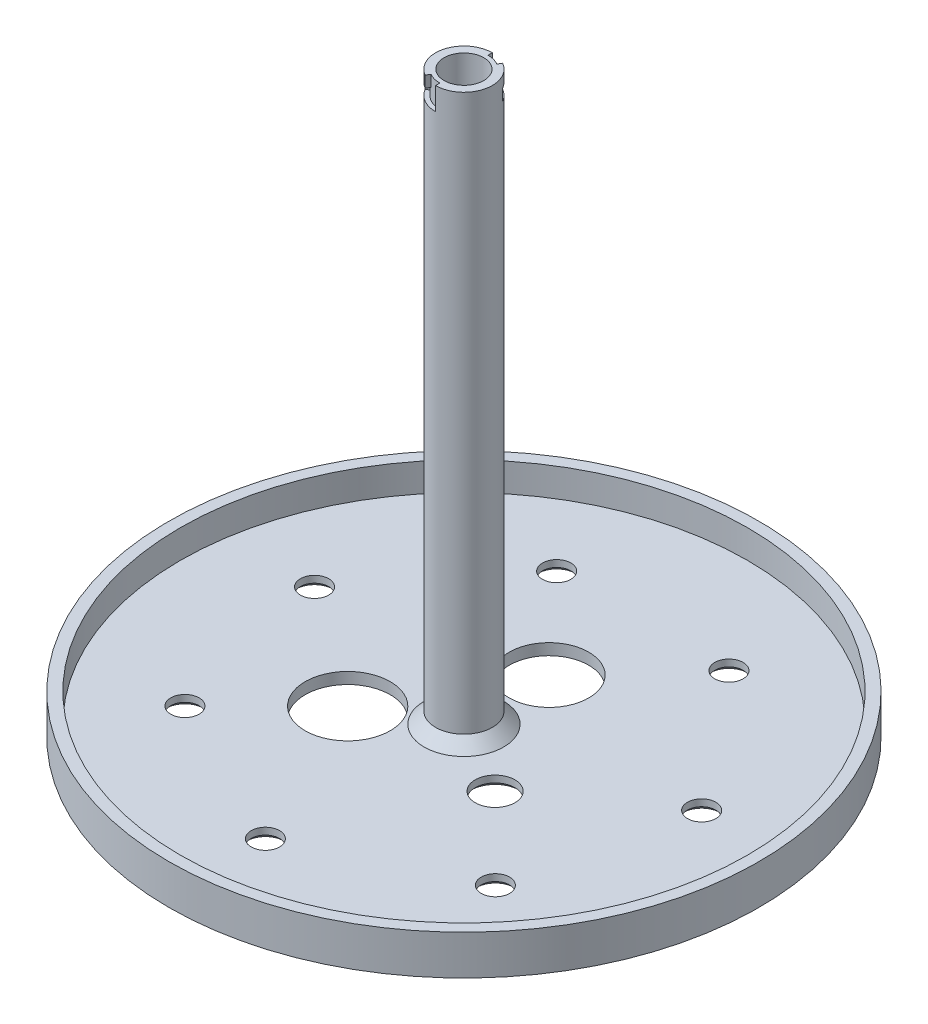
from build123d import *

# Parameters (mm, degrees)
SKETCH1_R                = 50
SKETCH1_R_2              = 7
SKETCH1_R_3              = 7.5
SKETCH1_R_4              = 3.5
BOSS_EXTRUDE1_DEPTH      = 2
SKETCH3_R                = 5
SKETCH3_R_2              = 3.5
BOSS_EXTRUDE2_DEPTH      = 100
CUT_EXTRUDE2_REACH       = 126.113
SKETCH6_R                = 2.5
CHAMFER2_SIZE            = 0.8
SKETCH7_W                = 0.75
SKETCH7_H                = 2
CUT_REVOLVE1_ANGLE       = 30
SKETCH7_4_W              = 0.75
SKETCH7_4_H              = 2
CUT_REVOLVE2_ANGLE       = 60
CIRPATTERN5_COUNT        = 2
BOSS_EXTRUDE3_DEPTH      = 5
BOSS_EXTRUDE3_DEPTH_BACK = 2
SKETCH8_R                = 52
SKETCH8_R_2              = 50
CHAMFER3_SIZE            = 2


with BuildPart() as part:
    # Sketch1 → Boss-Extrude1 (new body)
    with BuildSketch(Plane(origin=(0, 0, 0), x_dir=(1, 0, 0), z_dir=(0, 1, 0))):
        Circle(SKETCH1_R)
        with Locations((0, 15)):
            Circle(SKETCH1_R_2, mode=Mode.SUBTRACT)
        with Locations((-12.990381057, -7.5)):
            Circle(SKETCH1_R_3, mode=Mode.SUBTRACT)
        with Locations((12.990381057, -7.5)):
            Circle(SKETCH1_R_4, mode=Mode.SUBTRACT)
        Circle(SKETCH1_R_4, mode=Mode.SUBTRACT)
    extrude(amount=BOSS_EXTRUDE1_DEPTH)

    # Sketch3 → Boss-Extrude2 (add)
    with BuildSketch(Plane(origin=(0, 2, 0), x_dir=(1, 0, 0), z_dir=(0, 1, 0))):
        Circle(SKETCH3_R)
        Circle(SKETCH3_R_2, mode=Mode.SUBTRACT)
    extrude(amount=BOSS_EXTRUDE2_DEPTH)

    # Sketch6 → Cut-Extrude2 (cut, up to next)
    with BuildSketch(Plane.XZ, mode=Mode.PRIVATE) as cut_extrude2_sk1:
        with Locations((27.364101886, 21.822143065)):
            Circle(SKETCH6_R)
    cut_extrude2_tool1 = extrude(cut_extrude2_sk1.sketch, amount=-CUT_EXTRUDE2_REACH, mode=Mode.PRIVATE) & part.part
    # Sketch6 → Cut-Extrude2 (cut, up to next)
    with BuildSketch(Plane.XZ, mode=Mode.PRIVATE) as cut_extrude2_sk2:
        with Locations((34.122476926, -7.788232688)):
            Circle(SKETCH6_R)
    cut_extrude2_tool2 = extrude(cut_extrude2_sk2.sketch, amount=-CUT_EXTRUDE2_REACH, mode=Mode.PRIVATE) & part.part
    # Sketch6 → Cut-Extrude2 (cut, up to next)
    with BuildSketch(Plane.XZ, mode=Mode.PRIVATE) as cut_extrude2_sk3:
        with Locations((0, 35)):
            Circle(SKETCH6_R)
    cut_extrude2_tool3 = extrude(cut_extrude2_sk3.sketch, amount=-CUT_EXTRUDE2_REACH, mode=Mode.PRIVATE) & part.part
    # Sketch6 → Cut-Extrude2 (cut, up to next)
    with BuildSketch(Plane.XZ, mode=Mode.PRIVATE) as cut_extrude2_sk4:
        with Locations((15.185930869, -31.533910377)):
            Circle(SKETCH6_R)
    cut_extrude2_tool4 = extrude(cut_extrude2_sk4.sketch, amount=-CUT_EXTRUDE2_REACH, mode=Mode.PRIVATE) & part.part
    # Sketch6 → Cut-Extrude2 (cut, up to next)
    with BuildSketch(Plane.XZ, mode=Mode.PRIVATE) as cut_extrude2_sk5:
        with Locations((-27.364101886, 21.822143065)):
            Circle(SKETCH6_R)
    cut_extrude2_tool5 = extrude(cut_extrude2_sk5.sketch, amount=-CUT_EXTRUDE2_REACH, mode=Mode.PRIVATE) & part.part
    # Sketch6 → Cut-Extrude2 (cut, up to next)
    with BuildSketch(Plane.XZ, mode=Mode.PRIVATE) as cut_extrude2_sk6:
        with Locations((-15.185930869, -31.533910377)):
            Circle(SKETCH6_R)
    cut_extrude2_tool6 = extrude(cut_extrude2_sk6.sketch, amount=-CUT_EXTRUDE2_REACH, mode=Mode.PRIVATE) & part.part
    # Sketch6 → Cut-Extrude2 (cut, up to next)
    with BuildSketch(Plane.XZ, mode=Mode.PRIVATE) as cut_extrude2_sk7:
        with Locations((-34.122476926, -7.788232688)):
            Circle(SKETCH6_R)
    cut_extrude2_tool7 = extrude(cut_extrude2_sk7.sketch, amount=-CUT_EXTRUDE2_REACH, mode=Mode.PRIVATE) & part.part
    add(cut_extrude2_tool1.solids().sort_by_distance((27.364102, 0, 21.822143))[0], mode=Mode.SUBTRACT)
    add(cut_extrude2_tool2.solids().sort_by_distance((34.122477, 0, -7.788233))[0], mode=Mode.SUBTRACT)
    add(cut_extrude2_tool3.solids().sort_by_distance((0, 0, 35))[0], mode=Mode.SUBTRACT)
    add(cut_extrude2_tool4.solids().sort_by_distance((15.185931, 0, -31.53391))[0], mode=Mode.SUBTRACT)
    add(cut_extrude2_tool5.solids().sort_by_distance((-27.364102, 0, 21.822143))[0], mode=Mode.SUBTRACT)
    add(cut_extrude2_tool6.solids().sort_by_distance((-15.185931, 0, -31.53391))[0], mode=Mode.SUBTRACT)
    add(cut_extrude2_tool7.solids().sort_by_distance((-34.122477, 0, -7.788233))[0], mode=Mode.SUBTRACT)

    # Chamfer2
    chamfer2_edges = [part.edges().sort_by_distance(p)[0] for p in [
        (-2.5, 0, 35),
        (-29.864101886, 0, 21.822143065),
        (-36.622476926, 0, -7.788232688),
        (-17.685930869, 0, -31.533910377),
        (24.864101886, 0, 21.822143065),
        (9.490381057, 0, 7.5),
        (31.622476926, 0, -7.788232688),
        (12.685930869, 0, -31.533910377),
    ]]
    chamfer(chamfer2_edges, length=CHAMFER2_SIZE)

    # Sketch7 → Cut-Revolve1 (revolve, cut)
    with BuildSketch(Plane(origin=(0, 0, 0), x_dir=(0, 0, -1), z_dir=(1, 0, 0))):
        with Locations((4.625, 101)):
            Rectangle(SKETCH7_W, SKETCH7_H)
    cut_revolve1 = revolve(axis=Axis((0, 102, 0), (0, -1, 0)), revolution_arc=CUT_REVOLVE1_ANGLE, mode=Mode.SUBTRACT)

    # Sketch7<4> → Cut-Revolve2 (revolve, cut)
    with BuildSketch(Plane(origin=(0, 0, 0), x_dir=(0, 0, -1), z_dir=(1, 0, 0))):
        with Locations((4.625, 99)):
            Rectangle(SKETCH7_4_W, SKETCH7_4_H)
    cut_revolve2 = revolve(axis=Axis((0, 102, 0), (0, -1, 0)), revolution_arc=CUT_REVOLVE2_ANGLE, mode=Mode.SUBTRACT)

    # CirPattern5: Cut-Revolve1, Cut-Revolve2 ×2 about axis
    cirpattern5_axis = Axis((0, 102, 0), (0, -1, 0))
    add([cut_revolve1.rotate(cirpattern5_axis, i * 360 / CIRPATTERN5_COUNT) for i in range(1, CIRPATTERN5_COUNT)], mode=Mode.SUBTRACT)
    add([cut_revolve2.rotate(cirpattern5_axis, i * 360 / CIRPATTERN5_COUNT) for i in range(1, CIRPATTERN5_COUNT)], mode=Mode.SUBTRACT)

    # Chamfer3
    chamfer3_edges = [part.edges().sort_by_distance(p)[0] for p in [
        (-5, 2, 0),
    ]]
    chamfer(chamfer3_edges, length=CHAMFER3_SIZE)


with BuildPart() as body_2:
    # Sketch8 → Boss-Extrude3 (new, two sides: drawn at the far end of the back side and taken through both)
    with BuildSketch(Plane(origin=(0, 2, 0), x_dir=(1, 0, 0), z_dir=(0, 1, 0)).offset(-BOSS_EXTRUDE3_DEPTH_BACK)):
        Circle(SKETCH8_R)
        Circle(SKETCH8_R_2, mode=Mode.SUBTRACT)
    extrude(amount=BOSS_EXTRUDE3_DEPTH + BOSS_EXTRUDE3_DEPTH_BACK)


solid = Compound([part.part, body_2.part])
